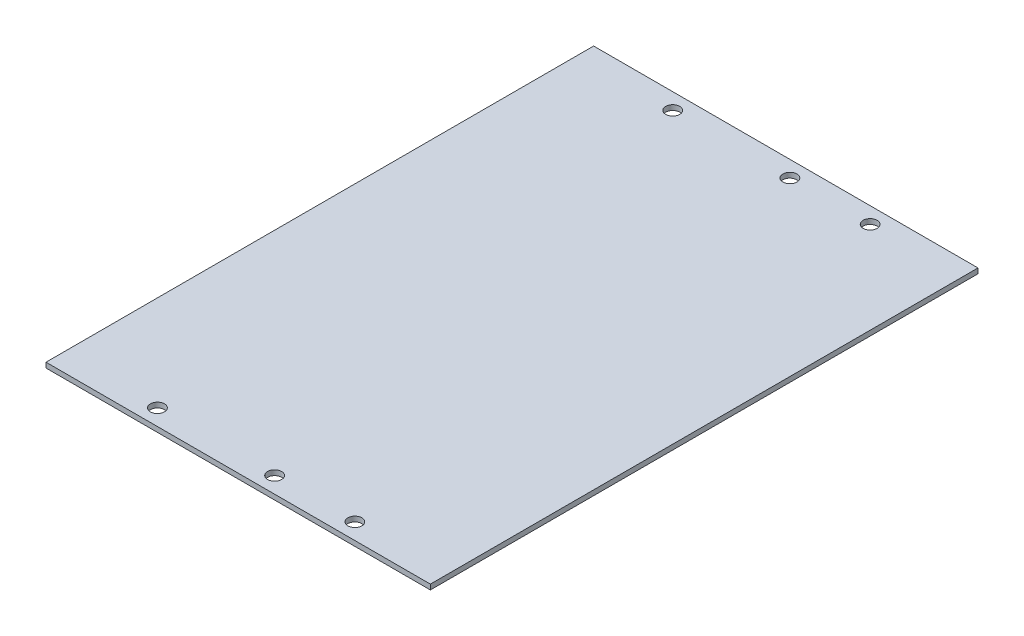
from build123d import *

# Parameters (mm, degrees)
SKETCH1_W           = 150.9
SKETCH1_H           = 215
SKETCH1_R           = 2.75
BOSS_EXTRUDE1_DEPTH = 2


with BuildPart() as part:
    # Sketch1 → Boss-Extrude1 (new body)
    with BuildSketch(Plane(origin=(0, 0, 0), x_dir=(1, 0, 0), z_dir=(0, 1, 0))):
        with Locations((75.45, 107.5)):
            Rectangle(SKETCH1_W, SKETCH1_H)
        with Locations((37.4, 208.65)):
            Circle(SKETCH1_R, mode=Mode.SUBTRACT)
        with Locations((83.4, 208.65)):
            Circle(SKETCH1_R, mode=Mode.SUBTRACT)
        with Locations((114.9, 208.65)):
            Circle(SKETCH1_R, mode=Mode.SUBTRACT)
        with Locations((114.9, 6.355)):
            Circle(SKETCH1_R, mode=Mode.SUBTRACT)
        with Locations((83.4, 6.355)):
            Circle(SKETCH1_R, mode=Mode.SUBTRACT)
        with Locations((37.4, 6.355)):
            Circle(SKETCH1_R, mode=Mode.SUBTRACT)
    extrude(amount=BOSS_EXTRUDE1_DEPTH)


solid = part.part
